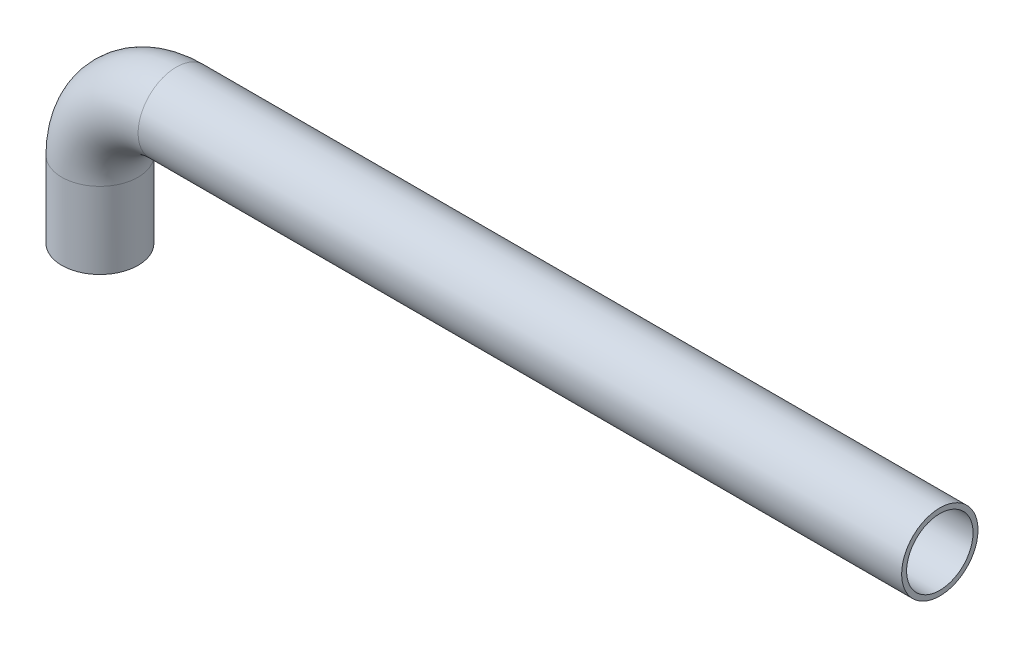
from build123d import *

# Parameters (mm, degrees)
SKETCH3_R            = 12.7
SKETCH3_R_2          = 11.049
BOSS_EXTRUDE1_DEPTH  = 127
SWEEP1_START         = -50.8
SWEEP1_OUTLINE_R     = 12.7
SWEEP1_OUTLINE_R_2   = 11.049
SWEEP1_DEPTH         = 25.4
SWEEP1_2_OUTLINE_R   = 12.7
SWEEP1_2_OUTLINE_R_2 = 11.049
SWEEP1_2_ANGLE       = 90


with BuildPart() as part:
    # Sketch3 → Boss-Extrude1 (new, symmetric)
    with BuildSketch(Plane(origin=(0, 0, 0), x_dir=(0, 0, -1), z_dir=(1, 0, 0))):
        Circle(SKETCH3_R)
        Circle(SKETCH3_R_2, mode=Mode.SUBTRACT)
    extrude(amount=BOSS_EXTRUDE1_DEPTH, both=True)



with BuildPart() as body_2:
    # Sweep1: read off the stored shape, not the designer's step
    # Sweep1 outline → Sweep1 (new body)
    with BuildSketch(Plane(origin=(0, 0, 0), x_dir=(1, 0, 0), z_dir=(0, 1, 0)).offset(SWEEP1_START)):
        with Locations((-152.4, 0)):
            Circle(SWEEP1_OUTLINE_R)
        with Locations((-152.4, 0)):
            Circle(SWEEP1_OUTLINE_R_2, mode=Mode.SUBTRACT)
    extrude(amount=SWEEP1_DEPTH)


with BuildPart() as part_1:
    add(part.part)

    add(body_2.part)  # Sweep1 2 merges body 2
    # Sweep1 2 outline → Sweep1 2 (revolve)
    with BuildSketch(Plane(origin=(-127, -25.4, 0), x_dir=(0, 1, 0), z_dir=(1, 0, 0))):
        with Locations((25.4, 0)):
            Circle(SWEEP1_2_OUTLINE_R)
        with Locations((25.4, 0)):
            Circle(SWEEP1_2_OUTLINE_R_2, mode=Mode.SUBTRACT)
    revolve(axis=Axis((-127, -25.4, 0), (0, 0, 1)), revolution_arc=SWEEP1_2_ANGLE)


solid = part_1.part
